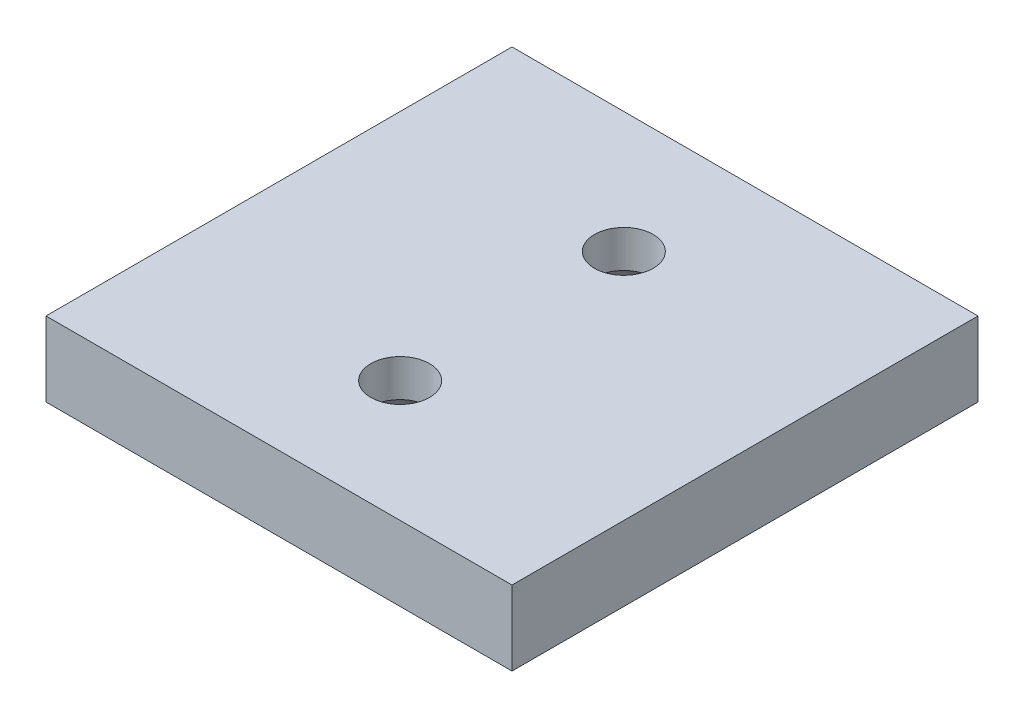
from build123d import *

# Parameters (mm, degrees)
SKETCH1_W           = 50
SKETCH1_H           = 50
BOSS_EXTRUDE1_DEPTH = 8
SKETCH2_R           = 6
CUT_EXTRUDE2_DEPTH  = 4
SKETCH4_R           = 3.15
CUT_EXTRUDE3_DEPTH  = 4
FILLET1_R           = 4


with BuildPart() as part:
    # Sketch1 → Boss-Extrude1 (new body)
    with BuildSketch(Plane(origin=(0, 0, 0), x_dir=(1, 0, 0), z_dir=(0, 1, 0))):
        Rectangle(SKETCH1_W, SKETCH1_H)
    extrude(amount=BOSS_EXTRUDE1_DEPTH)

    # Sketch2 → Cut-Extrude2 (cut)
    with BuildSketch(Plane(origin=(0, 0, 0), x_dir=(1, 0, 0), z_dir=(0, 1, 0))):
        with Locations(Location((0, -12, 0), (0, 0, 270))):
            Circle(SKETCH2_R)
        with Locations(Location((0, 12, 0), (0, 0, 90))):
            Circle(SKETCH2_R)
    extrude(amount=CUT_EXTRUDE2_DEPTH, mode=Mode.SUBTRACT)

    # Sketch4 → Cut-Extrude3 (cut)
    with BuildSketch(Plane.XZ.offset(-4)):
        with Locations(Location((0, -12, 0), (0, 0, 270))):
            Circle(SKETCH4_R)
        with Locations(Location((0, 12, 0), (0, 0, 90))):
            Circle(SKETCH4_R)
    extrude(amount=-CUT_EXTRUDE3_DEPTH, mode=Mode.SUBTRACT)

    # Fillet1
    # the kernel refuses this fillet: 4 mm, written as the material it adds along each edge
    with BuildSketch(Plane(origin=(0, 4, 12), x_dir=(0, 0, 1), z_dir=(-1, 0, 0))) as fillet1_piece_1:
        with BuildLine():
            CenterArc((2, -3.831122551), FILLET1_R, 0, 73.291656284)
            Line((3.15, 0), (3.173, 0.076622451))
            ThreePointArc((3.173, 0.076622451), (4.575, 0.08), (6, 0.08))
            Line((6, 0.08), (6.08, 0))
            Line((6.08, 0), (6.08, -3.831122551))
            Line((6.08, -3.831122551), (6, -3.831122551))
        make_face()
    revolve(axis=Axis((0, 4, 12), (0, 1, 0)))
    with BuildSketch(Plane(origin=(0, 4, -12), x_dir=(0, 0, -1), z_dir=(1, 0, 0))) as fillet1_piece_2:
        with BuildLine():
            CenterArc((2, -3.831122551), FILLET1_R, 0, 73.291656284)
            Line((3.15, 0), (3.173, 0.076622451))
            ThreePointArc((3.173, 0.076622451), (4.575, 0.08), (6, 0.08))
            Line((6, 0.08), (6.08, 0))
            Line((6.08, 0), (6.08, -3.831122551))
            Line((6.08, -3.831122551), (6, -3.831122551))
        make_face()
    revolve(axis=Axis((0, 4, -12), (0, 1, 0)))


solid = part.part
